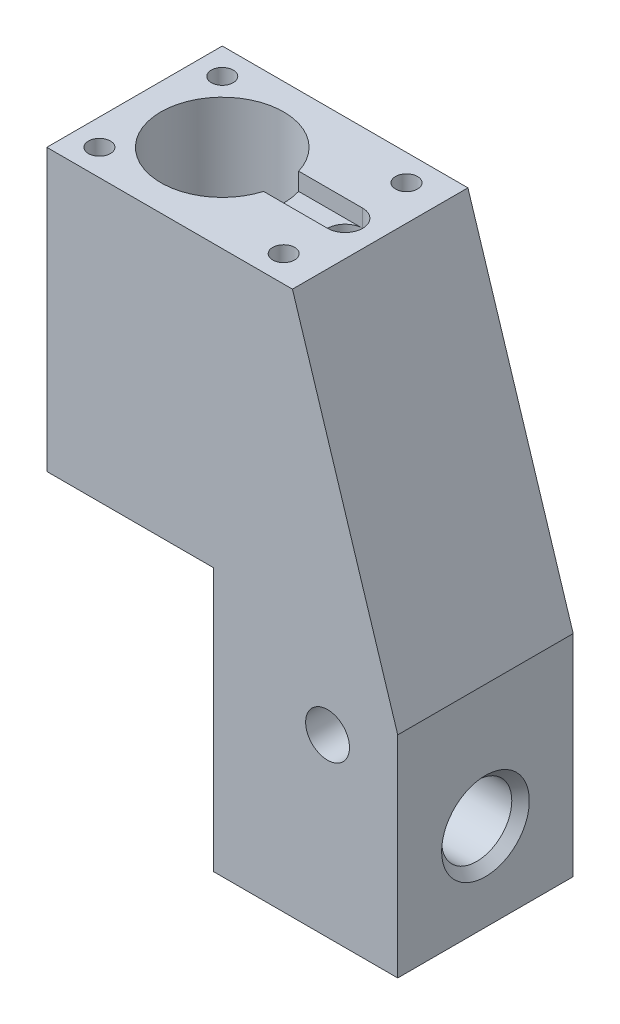
from build123d import *

# Parameters (mm, degrees)
BOSS_EXTRUDE1_DEPTH      = 10
CUT_EXTRUDE1_DEPTH       = 67.219333
CUT_EXTRUDE2_DEPTH       = 2
M3_TAPPED_HOLE1_D        = 2.5
M3_TAPPED_HOLE1_DEPTH    = 9
M3_TAPPED_HOLE1_TIP      = 0.751076
SKETCH6_R                = 2.5
CUT_EXTRUDE3_DEPTH       = 44.185646
SKETCH7_R                = 4
CUT_EXTRUDE4_DEPTH       = 53.191953
CHAMFER1_SIZE            = 1
HOLE1_START              = 2
HOLE1_OUTLINE_R          = 2
HOLE1_DEPTH              = 28
HOLE1_START_2            = -17
HOLE1_2_OUTLINE_R        = 1.25
HOLE1_2_DEPTH            = 19
CUT_EXTRUDE5_REACH       = 54.192
CUT_EXTRUDE5_END_RADIUS  = 7
SKETCH10_R               = 1.6
CUT_EXTRUDE6_START       = -6.35617
CUT_EXTRUDE6_OUTLINE_R   = 1.65
CUT_EXTRUDE6_DEPTH       = 6.35617
CUT_EXTRUDE6_START_2     = -17.834937
CUT_EXTRUDE6_2_OUTLINE_R = 1.25
CUT_EXTRUDE6_2_DEPTH     = 11.478767


with BuildPart() as part:
    # Sketch2 → Boss-Extrude1 (new, symmetric)
    with BuildSketch(Plane.XY):
        Polygon((0, 0), (-19, 0), (-19, 32), (9, 32), (21, -6), (21, -30), (0, -30), align=None)
    extrude(amount=BOSS_EXTRUDE1_DEPTH, both=True)

    # Sketch3 → Cut-Extrude1 (cut, through all)
    with BuildSketch(Plane(origin=(0, 32, 0), x_dir=(1, 0, 0), z_dir=(0, 1, 0))):
        with BuildLine():
            ThreePointArc((-2.291796, 2), (-10.010587, 6.926667), (-16, 0))
            Line((-16, 0), (-2, 0))
            ThreePointArc((-2, 0), (-2.073333, 1.010587), (-2.291796, 2))
        make_face()
        with BuildLine():
            Line((-2, 0), (-16, 0))
            ThreePointArc((-16, 0), (-10.010587, -6.926667), (-2.291796, -2))
            ThreePointArc((-2.291796, -2), (-2.073333, -1.010587), (-2, 0))
        make_face()
    extrude(amount=-CUT_EXTRUDE1_DEPTH, mode=Mode.SUBTRACT)

    # Sketch3<3> → Cut-Extrude2 (cut)
    with BuildSketch(Plane(origin=(0, 32, 0), x_dir=(1, 0, 0), z_dir=(0, 1, 0))):
        with BuildLine():
            ThreePointArc((-2.291796, 2), (-2.073333, 1.010587), (-2, 0))
            Line((-2, 0), (3, 0))
            ThreePointArc((3, 0), (3.585786, 1.414214), (5, 2))
            Line((5, 2), (-2.291796, 2))
        make_face()
        with BuildLine():
            Line((3, 0), (-2, 0))
            ThreePointArc((-2, 0), (-2.073333, -1.010587), (-2.291796, -2))
            Line((-2.291796, -2), (5, -2))
            ThreePointArc((5, -2), (3.585786, -1.414214), (3, 0))
        make_face()
        with BuildLine():
            ThreePointArc((5, 2), (3.585786, 1.414214), (3, 0))
            Line((3, 0), (7, 0))
            ThreePointArc((7, 0), (6.414214, 1.414214), (5, 2))
        make_face()
        with BuildLine():
            Line((7, 0), (3, 0))
            ThreePointArc((3, 0), (3.585786, -1.414214), (5, -2))
            ThreePointArc((5, -2), (6.414214, -1.414214), (7, 0))
        make_face()
    extrude(amount=-CUT_EXTRUDE2_DEPTH, mode=Mode.SUBTRACT)

    # M3 Tapped Hole1
    with Locations(Plane(origin=(0, 32, 0), x_dir=(1, 0, 0), z_dir=(0, 1, 0))):
        with Locations((-16, 7), (-16, -7), (5, -7), (5, 7)):
            Hole(M3_TAPPED_HOLE1_D / 2, depth=M3_TAPPED_HOLE1_DEPTH)
            with Locations((0, 0, -(M3_TAPPED_HOLE1_DEPTH + M3_TAPPED_HOLE1_TIP / 2))):  # 118° drill point
                Cone(0, M3_TAPPED_HOLE1_D / 2, M3_TAPPED_HOLE1_TIP, mode=Mode.SUBTRACT)

    # Sketch6 → Cut-Extrude3 (cut, through all)
    with BuildSketch(Plane.XY.offset(10)):
        with Locations((13, -10)):
            Circle(SKETCH6_R)
    extrude(amount=-CUT_EXTRUDE3_DEPTH, mode=Mode.SUBTRACT)

    # Sketch7 → Cut-Extrude4 (cut, through all)
    with BuildSketch(Plane(origin=(21, 0, 0), x_dir=(0, 0, -1), z_dir=(1, 0, 0))):
        with Locations((0, -20)):
            Circle(SKETCH7_R)
    extrude(amount=-CUT_EXTRUDE4_DEPTH, mode=Mode.SUBTRACT)

    # Chamfer1
    chamfer1_edges = [part.edges().sort_by_distance(p)[0] for p in [
        (21, -20, 4),
    ]]
    chamfer(chamfer1_edges, length=CHAMFER1_SIZE)

    # Hole1: read off the stored shape, not the designer's step
    # Hole1 outline → Hole1 (cut)
    with BuildSketch(Plane(origin=(0, 0, 0), x_dir=(1, 0, 0), z_dir=(0, 1, 0)).offset(HOLE1_START)):
        with Locations((5, 0)):
            Circle(HOLE1_OUTLINE_R)
    extrude(amount=HOLE1_DEPTH, mode=Mode.SUBTRACT)

    # Hole1 2 outline → Hole1 2 (cut)
    with BuildSketch(Plane(origin=(0, 0, 0), x_dir=(1, 0, 0), z_dir=(0, 1, 0)).offset(HOLE1_START_2)):
        with Locations((5, 0)):
            Circle(HOLE1_2_OUTLINE_R)
    extrude(amount=HOLE1_2_DEPTH, mode=Mode.SUBTRACT)

    # Cut-Extrude5: up to this cylinder (the profile starts outside it)
    cut_extrude5_end = Plane(origin=(-9, 15, 0), z_dir=(0, 1, 0)) * Cylinder(CUT_EXTRUDE5_END_RADIUS, 123.384, mode=Mode.PRIVATE)
    # Sketch10 → Cut-Extrude5 (cut, up to the surface)
    with BuildSketch(Plane.ZY.offset(19), mode=Mode.PRIVATE) as cut_extrude5_sk1:
        with Locations((-3, 15)):
            Circle(SKETCH10_R)
    cut_extrude5_tool1 = extrude(cut_extrude5_sk1.sketch, amount=-CUT_EXTRUDE5_REACH, mode=Mode.PRIVATE) - cut_extrude5_end
    add(cut_extrude5_tool1.solids().sort_by_distance((-19, 15, -3))[0], mode=Mode.SUBTRACT)
    # Sketch10 → Cut-Extrude5 (cut, up to the surface)
    with BuildSketch(Plane.ZY.offset(19), mode=Mode.PRIVATE) as cut_extrude5_sk2:
        with Locations((3, 15)):
            Circle(SKETCH10_R)
    cut_extrude5_tool2 = extrude(cut_extrude5_sk2.sketch, amount=-CUT_EXTRUDE5_REACH, mode=Mode.PRIVATE) - cut_extrude5_end
    add(cut_extrude5_tool2.solids().sort_by_distance((-19, 15, 3))[0], mode=Mode.SUBTRACT)

    # Cut-Extrude6: read off the stored shape, not the designer's step
    # Cut-Extrude6 outline → Cut-Extrude6 (cut)
    with BuildSketch(Plane.XZ.offset(30).offset(CUT_EXTRUDE6_START)):
        with Locations((5, 0)):
            Circle(CUT_EXTRUDE6_OUTLINE_R)
        with Locations((13, 0)):
            Circle(CUT_EXTRUDE6_OUTLINE_R)
    extrude(amount=CUT_EXTRUDE6_DEPTH, mode=Mode.SUBTRACT)

    # Cut-Extrude6 2 outline → Cut-Extrude6 2 (cut)
    with BuildSketch(Plane.XZ.offset(30).offset(CUT_EXTRUDE6_START_2)):
        with Locations((13, 0)):
            Circle(CUT_EXTRUDE6_2_OUTLINE_R)
    extrude(amount=CUT_EXTRUDE6_2_DEPTH, mode=Mode.SUBTRACT)


solid = part.part
